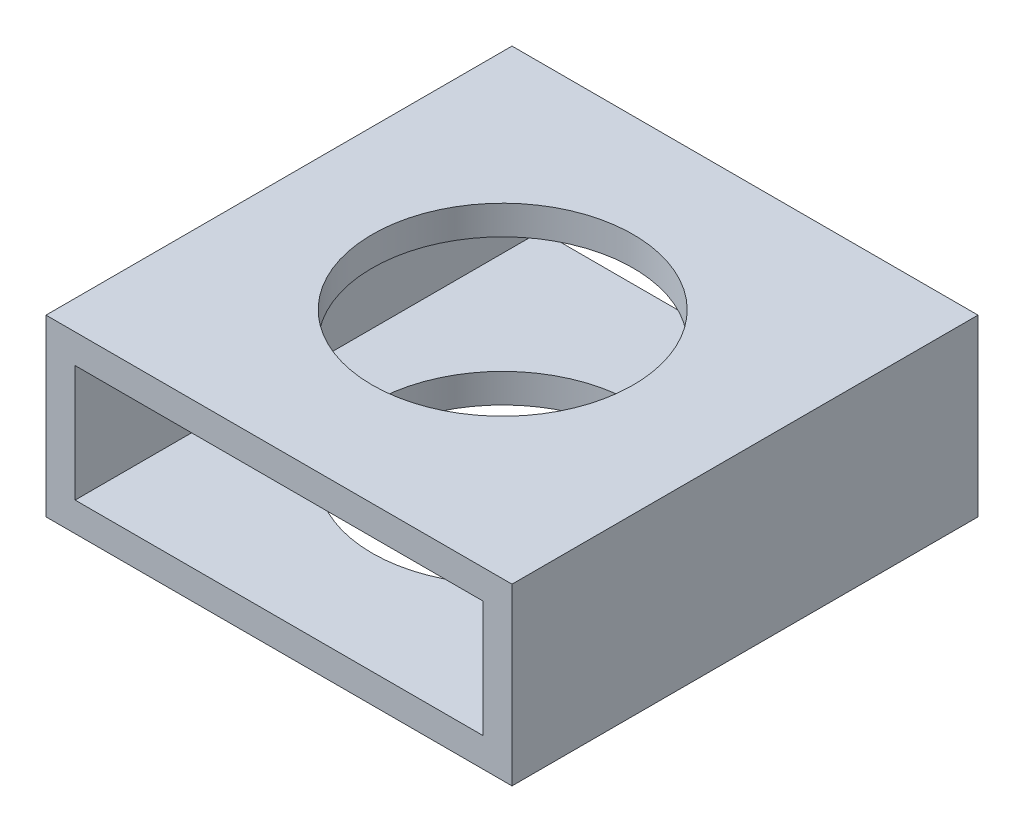
from build123d import *

# Parameters (mm, degrees)
SKETCH1_W           = 50.8
SKETCH1_H           = 19.05
BOSS_EXTRUDE1_DEPTH = 50.8
SKETCH2_W           = 44.45
SKETCH2_H           = 12.7
CUT_EXTRUDE1_DEPTH  = 80.624293441
SKETCH5_R           = 14.224
CUT_EXTRUDE2_DEPTH  = 80.10240824


with BuildPart() as part:
    # Sketch1 → Boss-Extrude1 (new body)
    with BuildSketch(Plane.XY):
        with Locations((-32.16429874, 11.587546426)):
            Rectangle(SKETCH1_W, SKETCH1_H)
    extrude(amount=BOSS_EXTRUDE1_DEPTH)

    # Sketch2 → Cut-Extrude1 (cut, through all)
    with BuildSketch(Plane(origin=(0, 0, 0), x_dir=(-1, 0, 0), z_dir=(0, 0, -1))):
        with Locations((32.16429874, 11.587546426)):
            Rectangle(SKETCH2_W, SKETCH2_H)
    extrude(amount=-CUT_EXTRUDE1_DEPTH, mode=Mode.SUBTRACT)

    # Sketch5 → Cut-Extrude2 (cut, through all)
    with BuildSketch(Plane(origin=(0, 21.112546426, 0), x_dir=(1, 0, 0), z_dir=(0, 1, 0))):
        with Locations((-33.18029874, -25.4)):
            Circle(SKETCH5_R)
    extrude(amount=-CUT_EXTRUDE2_DEPTH, mode=Mode.SUBTRACT)


solid = part.part
